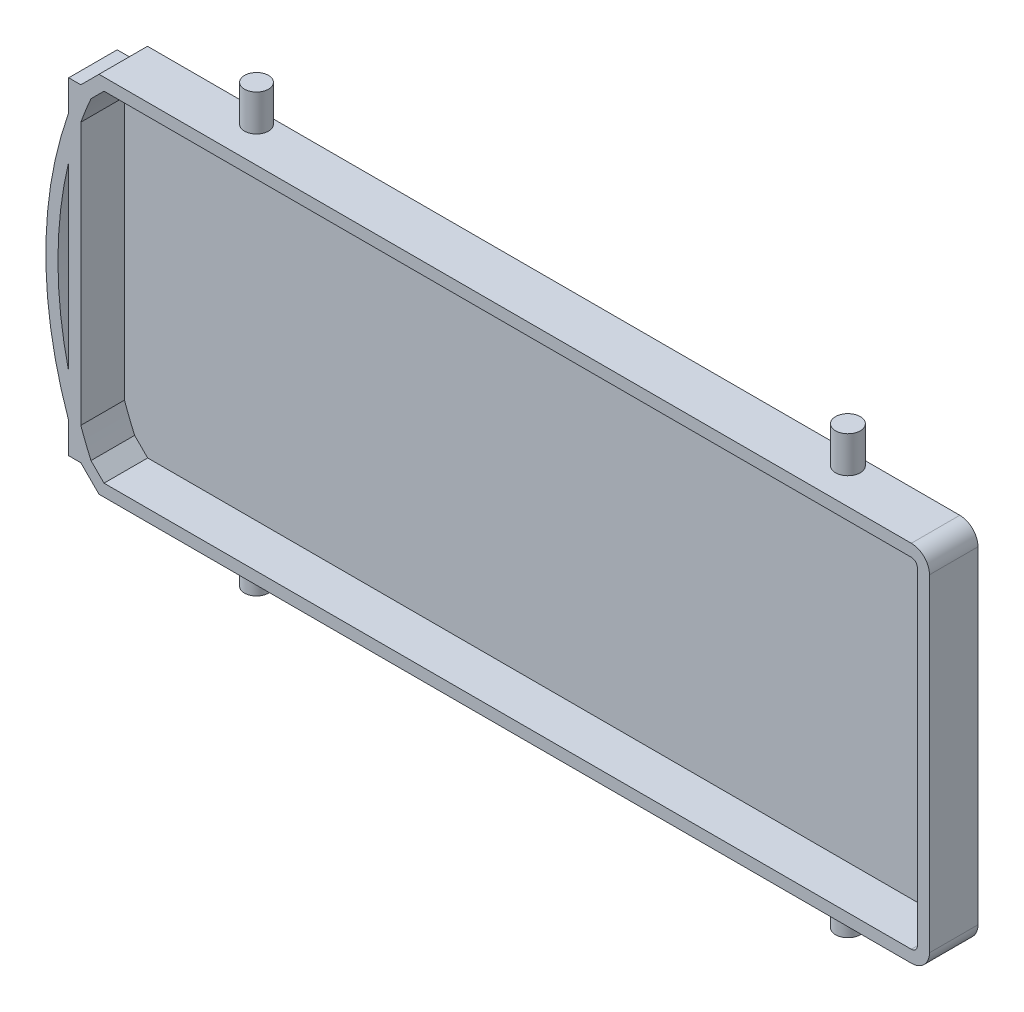
from build123d import *

# Parameters (mm, degrees)
SKETCH_2_R        = 9.874937623
EXTRUDE_1_DEPTH   = 40
SKETCH_2_R_2      = 10.181689967
EXTRUDE_1_2_DEPTH = 40
EXTRUDE_1_3_DEPTH = 40
EXTRUDE_5_DEPTH   = 40
EXTRUDE_2_DEPTH   = 4


# Read off the part's stored shape, not the designer's step: 拉伸-薄壁1
with BuildPart() as part:
    # 草图2 → Extrude 1 (new body)
    with BuildSketch(Plane(origin=(0, 140, 0), x_dir=(1, 0, 0), z_dir=(0, 1, 0))):
        with Locations(Location((-234.331213423, -10.749627478, 0), (0, 0, 270))):
            Circle(SKETCH_2_R)
    extrude_1 = extrude(amount=EXTRUDE_1_DEPTH)



with BuildPart() as body_2:
    # 草图2 → Extrude 1 2 (new body)
    with BuildSketch(Plane(origin=(0, 140, 0), x_dir=(1, 0, 0), z_dir=(0, 1, 0))):
        with Locations(Location((253.431386216, -10.749627478, 0), (0, 0, 270))):
            Circle(SKETCH_2_R_2)
    extrude_1_2 = extrude(amount=EXTRUDE_1_2_DEPTH)


with BuildPart() as part_1:
    add(part.part)

    add(body_2.part)  # Extrude 1 3 merges body 2
    # Extrude 1 3 outline → Extrude 1 3 (add)
    with BuildSketch(Plane.XY):
        with BuildLine():
            Line((-360, -135), (-350, -135))
            Line((-350, -135), (-335, -150))
            Line((-335, -150), (335, -150))
            ThreePointArc((335, -150), (345.606601718, -145.606601718), (350, -135))
            Line((350, -135), (350, 135))
            ThreePointArc((350, 135), (345.606601718, 145.606601718), (335, 150))
            Line((335, 150), (-335, 150))
            Line((-335, 150), (-335, 140))
            Line((-335, 140), (335, 140))
            ThreePointArc((335, 140), (338.535533906, 138.535533906), (340, 135))
            Line((340, 135), (340, -135))
            ThreePointArc((340, -135), (338.535533906, -138.535533906), (335, -140))
            Line((335, -140), (-330.857864376, -140))
            Line((-330.857864376, -140), (-341.617461171, -129.240403205))
            ThreePointArc((-341.617461171, -129.240403205), (-345.993586414, -118.835156387), (-350, -108.282039139))
            Line((-350, -108.282039139), (-350, 108.282039139))
            ThreePointArc((-350, 108.282039139), (-345.653254032, 119.682560505), (-340.875063682, 130.909090909))
            Line((-340.875063682, 130.909090909), (-350, 135))
            Line((-350, 135), (-360, 135))
            Line((-360, 135), (-360, 110.011554075))
            ThreePointArc((-360, 110.011554075), (-378.877101502, 0), (-360, -110.011554075))
            Line((-360, -110.011554075), (-360, -135))
        make_face()
        with BuildLine():
            Line((-360, 74.850130461), (-360, -74.850130461))
            ThreePointArc((-360, -74.850130461), (-368.877101502, 0), (-360, 74.850130461))
        make_face(mode=Mode.SUBTRACT)
    extrude(amount=EXTRUDE_1_3_DEPTH)

    # 镜向3: Extrude 1, Extrude 1 2 across plane
    add(extrude_1.mirror(Plane.ZX))
    add(extrude_1_2.mirror(Plane.ZX))

    # 草图1<3> → 拉伸-薄壁5 (add)
    with BuildSketch(Plane.XY):
        Polygon((-350, 135), (-335, 150), (-327.928932188, 142.928932188), (-342.928932188, 127.928932188), align=None)
    extrude(amount=EXTRUDE_5_DEPTH)

    # 草图1<4> → 凸台-拉伸2 (add)
    with BuildSketch(Plane.XY):
        with BuildLine():
            Line((-335, -150), (335, -150))
            ThreePointArc((335, -150), (345.606601718, -145.606601718), (350, -135))
            Line((350, -135), (350, 135))
            ThreePointArc((350, 135), (345.606601718, 145.606601718), (335, 150))
            Line((335, 150), (-335, 150))
            Line((-335, 150), (-350, 135))
            Line((-350, 135), (-350, -135))
            Line((-350, -135), (-335, -150))
        make_face()
    extrude(amount=EXTRUDE_2_DEPTH)


solid = part_1.part
